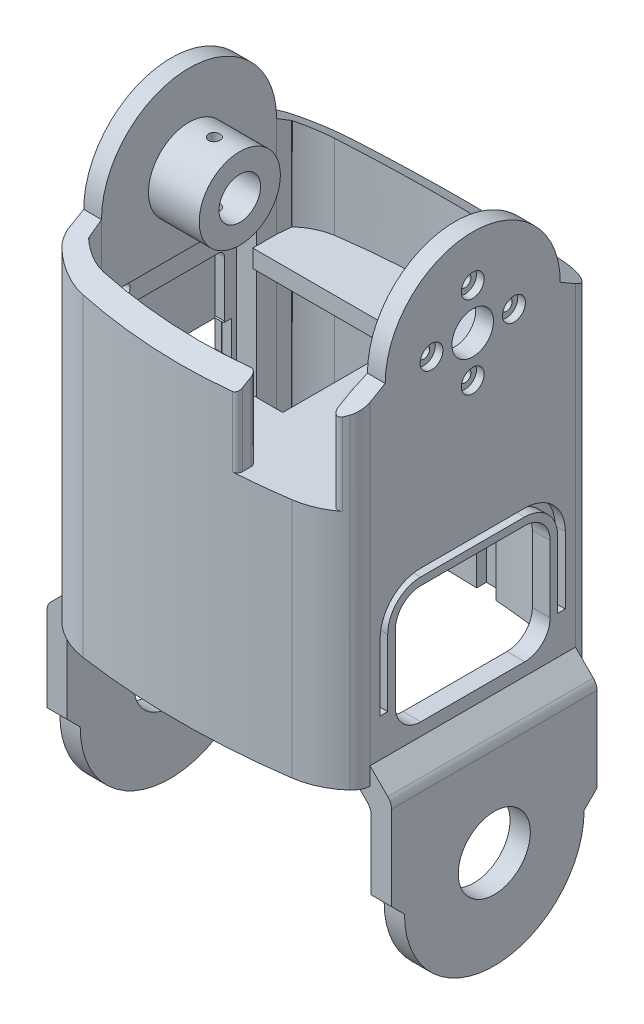
from build123d import *

# Parameters (mm, degrees)
SKETCH1_R                = 4.1
SKETCH1_R_2              = 1.15
BOSS_EXTRUDE1_DEPTH      = 3.5
BOSS_EXTRUDE2_DEPTH      = 67.25
CUT_EXTRUDE1_DEPTH       = 94.994268442
SKETCH4_W                = 26.5
SKETCH4_H                = 47.25
CUT_EXTRUDE2_DEPTH       = 3.5
SKETCH6_W                = 31.5
SKETCH6_H                = 52.25
BOSS_EXTRUDE3_DEPTH      = 2
CHAMFER2_SIZE            = 2
SKETCH7_W                = 26.5
SKETCH7_H                = 47.25
CUT_EXTRUDE3_DEPTH       = 0.8
CUT_EXTRUDE4_REACH       = 97.271
SKETCH8_W                = 21.401119101
SKETCH8_H                = 6.5
CUT_EXTRUDE5_REACH       = 97.271
SKETCH9_R                = 7.1
BOSS_EXTRUDE4_DEPTH      = 3.5
SKETCH11_W               = 4
SKETCH11_H               = 49.717369648
BOSS_EXTRUDE5_DEPTH      = 40
SKETCH12_R               = 7.1
CUT_EXTRUDE6_DEPTH       = 10
CHAMFER3_SIZE            = 1
CHAMFER4_SIZE            = 1
FILLET1_R                = 3
SKETCH13_R               = 9
SKETCH13_R_2             = 5.5
BOSS_EXTRUDE6_DEPTH      = 1.5
SKETCH16_R               = 9
BOSS_EXTRUDE7_DEPTH      = 1
FILLET2_R                = 1
SKETCH18_R               = 9
SKETCH18_R_2             = 7.1
BOSS_EXTRUDE8_DEPTH      = 0.5
CHAMFER5_SIZE            = 0.5
BOSS_EXTRUDE9_DEPTH      = 40.5
CUT_EXTRUDE8_REACH       = 129.458
CHAMFER6_SIZE            = 1.5
CUT_EXTRUDE9_REACH       = 129.458
SKETCH20_R               = 7.1
SKETCH21_R               = 1.5
BOSS_EXTRUDE10_DEPTH     = 3.5
CUT_EXTRUDE10_REACH      = 129.458
SKETCH22_R               = 3.75
SKETCH23_R               = 1.15
BOSS_EXTRUDE11_DEPTH     = 1.82
BOSS_EXTRUDE12_START     = 2.65
SKETCH24_W               = 5
SKETCH24_H               = 15.934069979
SKETCH24_R               = 1.15
BOSS_EXTRUDE12_DEPTH     = 2.65
CUT_EXTRUDE11_REACH      = 118.561
SKETCH25_R               = 1.15
SKETCH26_R               = 13.375
CUT_EXTRUDE12_DEPTH      = 3.3
SKETCH27_R               = 5
BOSS_EXTRUDE13_DEPTH     = 1
FILLET7_R                = 0.75
SKETCH28_R               = 8
SKETCH28_R_2             = 4.1
BOSS_EXTRUDE14_DEPTH     = 1.5
SKETCH29_R               = 8
SKETCH29_R_2             = 4.1
BOSS_EXTRUDE15_DEPTH     = 8.5
CUT_EXTRUDE13_DEPTH      = 15
CUT_EXTRUDE13_DEPTH_BACK = 127.447026853
SKETCH30_R               = 1.125
SKETCH31_R               = 7.1
BOSS_EXTRUDE16_DEPTH     = 0.5
CHAMFER7_SIZE            = 0.5
CHAMFER7_OF_MIRROR5_SIZE = 0.5
FILLET8_R                = 2.5
CUT_EXTRUDE14_DEPTH      = 10
CUT_EXTRUDE14_DEPTH_BACK = 10
SKETCH32_W               = 30.5
SKETCH32_H               = 23.22
FILLET9_R                = 5
CUT_EXTRUDE15_DEPTH      = 2
SKETCH34_R               = 2.25
CUT_EXTRUDE16_DEPTH      = 1.5
CUT_EXTRUDE17_DEPTH      = 133.651095359
CUT_EXTRUDE17_DEPTH_BACK = 2
SKETCH35_W               = 15
SKETCH35_H               = 21.75
FILLET10_R               = 1
FILLET11_R               = 1
SKETCH36_R               = 1.15
CUT_EXTRUDE18_DEPTH      = 127.188133356
CUT_EXTRUDE20_DEPTH      = 10
CUT_EXTRUDE20_DEPTH_BACK = 40


# Some blends are built 0.0001 mm under size
with BuildPart() as part:
    # Sketch1 → Boss-Extrude1 (new body)
    with BuildSketch(Plane(origin=(0, 0, 0), x_dir=(0, 0, -1), z_dir=(1, 0, 0))):
        with BuildLine():
            Line((-17.25, 0), (-17.25, -67.25))
            Line((-17.25, -67.25), (17.25, -67.25))
            Line((17.25, -67.25), (17.25, 0))
            ThreePointArc((17.25, 0), (0, 17.25), (-17.25, 0))
        make_face()
        Circle(SKETCH1_R, mode=Mode.SUBTRACT)
        with Locations((0, 8.125)):
            Circle(SKETCH1_R_2, mode=Mode.SUBTRACT)
        with Locations((8.125, 0)):
            Circle(SKETCH1_R_2, mode=Mode.SUBTRACT)
        with Locations((-8.125, 0)):
            Circle(SKETCH1_R_2, mode=Mode.SUBTRACT)
        with Locations((0, -8.125)):
            Circle(SKETCH1_R_2, mode=Mode.SUBTRACT)
    boss_extrude1 = extrude(amount=BOSS_EXTRUDE1_DEPTH)

    # Sketch2 → Boss-Extrude2 (add)
    with BuildSketch(Plane(origin=(0, 0, 0), x_dir=(-1, 0, 0), z_dir=(0, -1, 0))):
        with BuildLine():
            Line((-59.4, -17.25), (-59.4, -20.25))
            ThreePointArc((-59.4, -20.25), (-58.989582055, -21.693064324), (-58.079872716, -22.886088403))
            ThreePointArc((-58.079872716, -22.886088403), (-54.454905265, -25.285822393), (-50.289145158, -26.529025904))
            ThreePointArc((-50.289145158, -26.529025904), (-40.020812264, -27.631788405), (-29.7, -28))
            ThreePointArc((-29.7, -28), (-19.379187736, -27.631788405), (-9.110854842, -26.529025904))
            ThreePointArc((-9.110854842, -26.529025904), (-4.945094735, -25.285822393), (-1.320127284, -22.886088403))
            ThreePointArc((-1.320127284, -22.886088403), (-0.410417945, -21.693064324), (0, -20.25))
            Line((0, -20.25), (0, -17.25))
            Line((0, -17.25), (-3.5, -17.25))
            Line((-3.5, -17.25), (-3.735903774, -19.954735321))
            ThreePointArc((-3.735903774, -19.954735321), (-3.770225997, -20.037754997), (-3.828562802, -20.106071165))
            ThreePointArc((-3.828562802, -20.106071165), (-6.407189742, -21.835001354), (-9.364778442, -22.779027613))
            ThreePointArc((-9.364778442, -22.779027613), (-19.505740765, -23.883479028), (-29.7, -24.2522722))
            ThreePointArc((-29.7, -24.2522722), (-39.894259235, -23.883479028), (-50.035221558, -22.779027613))
            ThreePointArc((-50.035221558, -22.779027613), (-52.992810258, -21.835001354), (-55.571437198, -20.106071165))
            ThreePointArc((-55.571437198, -20.106071165), (-55.629774003, -20.037754997), (-55.664096226, -19.954735321))
            Line((-55.664096226, -19.954735321), (-55.9, -17.25))
            Line((-55.9, -17.25), (-59.4, -17.25))
        make_face()
    boss_extrude2 = extrude(amount=BOSS_EXTRUDE2_DEPTH)

    # Mirror2: Boss-Extrude1 across plane
    add(boss_extrude1.mirror(Plane.ZY.offset(-29.7)))

    # Sketch3 → Cut-Extrude1 (cut, through all)
    with BuildSketch(Plane.ZY):
        Polygon((17.25, 0), (32.748612496, -8.948128097), (32.748612496, 0), align=None)
    cut_extrude1 = extrude(amount=-CUT_EXTRUDE1_DEPTH, mode=Mode.SUBTRACT)

    # Mirror3: Boss-Extrude2, Cut-Extrude1 across plane
    add(boss_extrude2.mirror(Plane(origin=(0, 0, 0), x_dir=(1, 0, 0), z_dir=(0, 0, -1))))
    add(cut_extrude1.mirror(Plane(origin=(0, 0, 0), x_dir=(1, 0, 0), z_dir=(0, 0, -1))), mode=Mode.SUBTRACT)

    # Sketch4 → Cut-Extrude2 (cut)
    with BuildSketch(Plane.ZY):
        with Locations((0, -37.125)):
            Rectangle(SKETCH4_W, SKETCH4_H)
    extrude(amount=-CUT_EXTRUDE2_DEPTH, mode=Mode.SUBTRACT)

    # Sketch6 → Boss-Extrude3 (add)
    with BuildSketch(Plane.ZY):
        with Locations((0, -37.125)):
            Rectangle(SKETCH6_W, SKETCH6_H)
    extrude(amount=BOSS_EXTRUDE3_DEPTH)

    # Chamfer2
    chamfer2_edges = [part.edges().sort_by_distance(p)[0] for p in [
        (-2, -63.25, 0),
        (-2, -37.125, 15.75),
        (-2, -37.125, -15.75),
        (-2, -11, 0),
    ]]
    chamfer(chamfer2_edges, length=CHAMFER2_SIZE - 0.0001)  # a hair under: the kernel refuses the full size

    # Sketch7 → Cut-Extrude3 (cut)
    with BuildSketch(Plane(origin=(0, 0, 0), x_dir=(0, 0, -1), z_dir=(1, 0, 0))):
        with Locations((0, -37.125)):
            Rectangle(SKETCH7_W, SKETCH7_H)
    extrude(amount=-CUT_EXTRUDE3_DEPTH, mode=Mode.SUBTRACT)

    # Sketch8 → Cut-Extrude4 (cut, up to next)
    with BuildSketch(Plane.ZY.offset(2), mode=Mode.PRIVATE) as cut_extrude4_sk1:
        with Locations((0.049440449, -35.5)):
            Rectangle(SKETCH8_W, SKETCH8_H)
    cut_extrude4_tool1 = extrude(cut_extrude4_sk1.sketch, amount=-CUT_EXTRUDE4_REACH, mode=Mode.PRIVATE) & part.part
    add(cut_extrude4_tool1.solids().sort_by_distance((-2, -35.5, 0.04944))[0], mode=Mode.SUBTRACT)

    # Sketch9 → Cut-Extrude5 (cut, up to next)
    with BuildSketch(Plane(origin=(59.4, 0, 0), x_dir=(0, 0, -1), z_dir=(1, 0, 0)), mode=Mode.PRIVATE) as cut_extrude5_sk1:
        with Locations((0, -49.64)):
            Circle(SKETCH9_R)
    cut_extrude5_tool1 = extrude(cut_extrude5_sk1.sketch, amount=-CUT_EXTRUDE5_REACH, mode=Mode.PRIVATE) & part.part
    add(cut_extrude5_tool1.solids().sort_by_distance((59.4, -49.64, 0))[0], mode=Mode.SUBTRACT)

    # Sketch10 → Boss-Extrude4 (add)
    with BuildSketch(Plane(origin=(0, -19.75, 0), x_dir=(-1, 0, 0), z_dir=(0, -1, 0))):
        with BuildLine():
            Line((-55.664096226, -19.954735321), (-55.9, -17.25))
            Line((-55.9, -17.25), (-55.9, 17.25))
            Line((-55.9, 17.25), (-55.664096226, 19.954735321))
            ThreePointArc((-55.664096226, 19.954735321), (-55.629774003, 20.037754997), (-55.571437198, 20.106071165))
            ThreePointArc((-55.571437198, 20.106071165), (-52.992810258, 21.835001354), (-50.035221558, 22.779027613))
            ThreePointArc((-50.035221558, 22.779027613), (-29.7, 24.2522722), (-9.364778442, 22.779027613))
            ThreePointArc((-9.364778442, 22.779027613), (-6.407189742, 21.835001354), (-3.828562802, 20.106071165))
            ThreePointArc((-3.828562802, 20.106071165), (-3.770225997, 20.037754997), (-3.735903774, 19.954735321))
            Line((-3.735903774, 19.954735321), (-3.5, 17.25))
            Line((-3.5, 17.25), (-3.5, 12.559999042))
            Line((-3.5, 12.559999042), (-34.519998723, 12.559999042))
            Line((-34.519998723, 12.559999042), (-34.519998723, -12.559999407))
            Line((-34.519998723, -12.559999407), (-3.5, -12.559999407))
            Line((-3.5, -12.559999407), (-3.5, -17.25))
            Line((-3.5, -17.25), (-3.735903774, -19.954735321))
            ThreePointArc((-3.735903774, -19.954735321), (-3.770225997, -20.037754997), (-3.828562802, -20.106071165))
            ThreePointArc((-3.828562802, -20.106071165), (-6.407189742, -21.835001354), (-9.364778442, -22.779027613))
            ThreePointArc((-9.364778442, -22.779027613), (-29.7, -24.2522722), (-50.035221558, -22.779027613))
            ThreePointArc((-50.035221558, -22.779027613), (-52.992810258, -21.835001354), (-55.571437198, -20.106071165))
            ThreePointArc((-55.571437198, -20.106071165), (-55.629774003, -20.037754997), (-55.664096226, -19.954735321))
        make_face()
    extrude(amount=BOSS_EXTRUDE4_DEPTH)

    # Sketch11 → Boss-Extrude5 (add)
    with BuildSketch(Plane(origin=(0, -23.25, 0), x_dir=(-1, 0, 0), z_dir=(0, -1, 0))):
        with Locations((-38.07, 0.750293773)):
            Rectangle(SKETCH11_W, SKETCH11_H)
    extrude(amount=BOSS_EXTRUDE5_DEPTH)

    # Sketch12 → Cut-Extrude6 (cut)
    with BuildSketch(Plane(origin=(40.07, 0, 0), x_dir=(0, 0, -1), z_dir=(1, 0, 0))):
        with Locations((0, -49.64)):
            Circle(SKETCH12_R)
    extrude(amount=-CUT_EXTRUDE6_DEPTH, mode=Mode.SUBTRACT)

    # Chamfer3
    chamfer3_edges = [part.edges().sort_by_distance(p)[0] for p in [
        (36.07, -23.25, 0),
    ]]
    chamfer(chamfer3_edges, length=CHAMFER3_SIZE)

    # Chamfer4
    chamfer4_edges = [part.edges().sort_by_distance(p)[0] for p in [
        (40.07, -23.25, 0),
    ]]
    chamfer(chamfer4_edges, length=CHAMFER4_SIZE)

    # Fillet1
    fillet1_edges = [part.edges().sort_by_distance(p)[0] for p in [
        (38.07084415, -63.25, 24.003715904),
        (38.07084415, -63.25, -24.003715904),
    ]]
    fillet(fillet1_edges, radius=FILLET1_R)

    # Sketch13 → Boss-Extrude6 (add)
    with BuildSketch(Plane(origin=(59.4, 0, 0), x_dir=(0, 0, -1), z_dir=(1, 0, 0))):
        with Locations(Location((0, -49.64, 0), (0, 0, 180))):
            Circle(SKETCH13_R)
        with Locations((0, -49.64)):
            Circle(SKETCH13_R_2, mode=Mode.SUBTRACT)
    extrude(amount=BOSS_EXTRUDE6_DEPTH)

    # Sketch16 → Boss-Extrude7 (add)
    with BuildSketch(Plane(origin=(60.9, 0, 0), x_dir=(0, 0, -1), z_dir=(1, 0, 0))):
        with Locations(Location((0, -49.64, 0), (0, 0, 180))):
            Circle(SKETCH16_R)
    extrude(amount=BOSS_EXTRUDE7_DEPTH)

    # Fillet2
    fillet2_edges = [part.edges().sort_by_distance(p)[0] for p in [
        (61.9, -49.64, -9),
    ]]
    fillet(fillet2_edges, radius=FILLET2_R)

    # Sketch18 → Boss-Extrude8 (add)
    with BuildSketch(Plane.ZY.offset(-55.9)):
        with Locations((0, -49.64)):
            Circle(SKETCH18_R)
        with Locations(Location((0, -49.64, 0), (0, 0, 180))):
            Circle(SKETCH18_R_2, mode=Mode.SUBTRACT)
    extrude(amount=BOSS_EXTRUDE8_DEPTH)

    # Chamfer5
    chamfer5_edges = [part.edges().sort_by_distance(p)[0] for p in [
        (55.9, -49.64, -9),
    ]]
    chamfer(chamfer5_edges, length=CHAMFER5_SIZE - 0.0001)  # a hair under: the kernel refuses the full size

    # Sketch17 → Boss-Extrude9 (add)
    with BuildSketch(Plane(origin=(0, 0, 20.25), x_dir=(-1, 0, 0), z_dir=(0, 0, -1))):
        Polygon((-59.65, -105.91), (-63.15, -105.91), (-63.15, -67.5), (-59.4, -63.75), (-59.4, -67.25), (-55.9, -67.25), (-59.65, -71), align=None)
    boss_extrude9 = extrude(amount=BOSS_EXTRUDE9_DEPTH)

    # Sketch19 → Cut-Extrude8 (cut, up to next)
    with BuildSketch(Plane(origin=(63.15, 0, 0), x_dir=(0, 0, -1), z_dir=(1, 0, 0)), mode=Mode.PRIVATE) as cut_extrude8_sk1:
        with BuildLine():
            ThreePointArc((0, -105.91), (-12.515790027, -100.725790027), (-17.7, -88.21))
            Line((-17.7, -88.21), (-20.25, -85.66))
            Line((-20.25, -85.66), (-20.25, -105.91))
            Line((-20.25, -105.91), (0, -105.91))
        make_face()
    cut_extrude8_tool1 = extrude(cut_extrude8_sk1.sketch, amount=-CUT_EXTRUDE8_REACH, mode=Mode.PRIVATE) & part.part
    # Sketch19 → Cut-Extrude8 (cut, up to next)
    with BuildSketch(Plane(origin=(63.15, 0, 0), x_dir=(0, 0, -1), z_dir=(1, 0, 0)), mode=Mode.PRIVATE) as cut_extrude8_sk2:
        with BuildLine():
            ThreePointArc((17.7, -88.21), (12.515790027, -100.725790027), (0, -105.91))
            Line((0, -105.91), (20.25, -105.91))
            Line((20.25, -105.91), (20.25, -85.66))
            Line((20.25, -85.66), (17.7, -88.21))
        make_face()
    cut_extrude8_tool2 = extrude(cut_extrude8_sk2.sketch, amount=-CUT_EXTRUDE8_REACH, mode=Mode.PRIVATE) & part.part
    cut_extrude8_1 = cut_extrude8_tool1.solids().sort_by_distance((63.15, -99.634492, 15.946502))[0]
    add(cut_extrude8_1, mode=Mode.SUBTRACT)
    cut_extrude8_2 = cut_extrude8_tool2.solids().sort_by_distance((63.15, -99.634492, -15.946502))[0]
    add(cut_extrude8_2, mode=Mode.SUBTRACT)
    cut_extrude8 = cut_extrude8_1 + cut_extrude8_2  # Cut-Extrude8 as one shape, for the pattern or mirror that repeats it

    # Chamfer6
    chamfer6_edges = [part.edges().sort_by_distance(p)[0] for p in [
        (59.4, -49.64, -9),
    ]]
    chamfer(chamfer6_edges, length=CHAMFER6_SIZE - 0.0001)  # a hair under: the kernel refuses the full size

    # Sketch20 → Cut-Extrude9 (cut, up to next)
    with BuildSketch(Plane(origin=(63.15, 0, 0), x_dir=(0, 0, -1), z_dir=(1, 0, 0)), mode=Mode.PRIVATE) as cut_extrude9_sk1:
        with Locations(Location((0, -86.64, 0), (0, 0, 90))):
            Circle(SKETCH20_R)
    cut_extrude9_tool1 = extrude(cut_extrude9_sk1.sketch, amount=-CUT_EXTRUDE9_REACH, mode=Mode.PRIVATE) & part.part
    cut_extrude9 = cut_extrude9_tool1.solids().sort_by_distance((63.15, -86.64, 0))[0]
    add(cut_extrude9, mode=Mode.SUBTRACT)

    # Sketch21 → Boss-Extrude10 (add)
    with BuildSketch(Plane.ZY):
        with Locations((0, 8.125)):
            Circle(SKETCH21_R)
        with Locations((8.125, 0)):
            Circle(SKETCH21_R)
        with Locations((0, -8.125)):
            Circle(SKETCH21_R)
        with Locations((-8.125, 0)):
            Circle(SKETCH21_R)
    extrude(amount=-BOSS_EXTRUDE10_DEPTH)

    # Mirror4: Boss-Extrude9, Cut-Extrude8, Cut-Extrude9 across plane
    add(boss_extrude9.mirror(Plane.ZY.offset(-29.7)))
    add(cut_extrude8.mirror(Plane.ZY.offset(-29.7)), mode=Mode.SUBTRACT)
    add(cut_extrude9.mirror(Plane.ZY.offset(-29.7)), mode=Mode.SUBTRACT)

    # Sketch22 → Cut-Extrude10 (cut, up to next)
    with BuildSketch(Plane.ZY.offset(2), mode=Mode.PRIVATE) as cut_extrude10_sk1:
        with Locations((0, -49.64)):
            Circle(SKETCH22_R)
    cut_extrude10_tool1 = extrude(cut_extrude10_sk1.sketch, amount=-CUT_EXTRUDE10_REACH, mode=Mode.PRIVATE) & part.part
    add(cut_extrude10_tool1.solids().sort_by_distance((-2, -49.64, 0))[0], mode=Mode.SUBTRACT)

    # Sketch23 → Boss-Extrude11 (add)
    with BuildSketch(Plane(origin=(-0.8, 0, 0), x_dir=(0, 0, -1), z_dir=(1, 0, 0))):
        with BuildLine():
            Line((10.8, -38.889999996), (6.999999457, -38.890000068))
            Line((6.999999457, -38.890000068), (6.999996312, -40.653616778))
            ThreePointArc((6.999996312, -40.653616778), (8.489057136, -42.044544733), (9.706479797, -43.678516819))
            Line((9.706479797, -43.678516819), (11.359988862, -43.678515032))
            ThreePointArc((11.359988862, -43.678515032), (11.713588357, -43.532032852), (11.859995379, -43.178403539))
            Line((11.859995379, -43.178403539), (11.86002914, -16.529542904))
            add(Edge.make_bspline(
                [(11.86002914, -16.529542904), (11.860165313, -16.430469267), (11.850209846, -16.333113479), (11.811929636, -16.141528813), (11.783134355, -16.046307589), (11.707972993, -15.864777212), (11.661801756, -15.778752889), (11.553004371, -15.615785201), (11.48982416, -15.538574617), (11.282494862, -15.331229176), (11.115347595, -15.219447642), (10.754781823, -15.069949312), (10.558116563, -15.029804422), (10.360121847, -15.029962825)],
                knots=[0, 0, 0, 0, 0.125, 0.125, 0.25, 0.25, 0.375, 0.375, 0.5, 0.5, 0.75, 0.75, 1, 1, 1, 1], degree=3))
            Line((10.360121847, -15.029962825), (-10.360414785, -15.029965499))
            add(Edge.make_bspline(
                [(-10.360414785, -15.029965499), (-10.459488561, -15.029826786), (-10.556844718, -15.039779883), (-10.748430568, -15.078055492), (-10.843652616, -15.10684852), (-11.025185073, -15.18200551), (-11.111210651, -15.228174695), (-11.274181245, -15.336968247), (-11.351393467, -15.400146655), (-11.558744183, -15.60747118), (-11.670529896, -15.774615995), (-11.820037045, -16.135178663), (-11.86018697, -16.331843248), (-11.860032668, -16.529838302)],
                knots=[0, 0, 0, 0, 0.125, 0.125, 0.25, 0.25, 0.375, 0.375, 0.5, 0.5, 0.75, 0.75, 1, 1, 1, 1], degree=3))
            Line((-11.860032668, -16.529838302), (-11.860001151, -43.178485794))
            ThreePointArc((-11.860001151, -43.178485794), (-11.713562299, -43.532062592), (-11.359992206, -43.678517633))
            Line((-11.359992206, -43.678517633), (-9.706483935, -43.678519702))
            ThreePointArc((-9.706483935, -43.678519702), (-8.489059663, -42.044544533), (-6.999996328, -40.653614235))
            Line((-6.999996328, -40.653614235), (-6.99999946, -38.890000068))
            Line((-6.99999946, -38.890000068), (-10.8, -38.889999996))
            Line((-10.8, -38.889999996), (-10.8, -32.115))
            Line((-10.8, -32.115), (-9.303042913, -32.115))
            Line((-9.303042913, -32.115), (-9.442286694, -31.892101192))
            Line((-9.442286694, -31.892101192), (-9.442286694, -20.936914675))
            ThreePointArc((-9.442286694, -20.936914675), (-9.09081483, -20.088386539), (-8.242286694, -19.736914678))
            Line((-8.242286694, -19.736914678), (8.242286696, -19.736914678))
            ThreePointArc((8.242286696, -19.736914678), (9.090814832, -20.088386541), (9.442286694, -20.936914678))
            Line((9.442286694, -20.936914678), (9.442286694, -31.892101192))
            Line((9.442286694, -31.892101192), (9.303042913, -32.115))
            Line((9.303042913, -32.115), (10.8, -32.115))
            Line((10.8, -32.115), (10.8, -38.889999996))
        make_face()
        with Locations(Location((-10.25, -16.89, 0), (0, 0, 180))):
            Circle(SKETCH23_R, mode=Mode.SUBTRACT)
        with Locations(Location((10.25, -16.89, 0), (0, 0, 180))):
            Circle(SKETCH23_R, mode=Mode.SUBTRACT)
        with Locations(Location((10.25, -41.34, 0), (0, 0, 180))):
            Circle(SKETCH23_R, mode=Mode.SUBTRACT)
        with Locations(Location((-10.25, -41.34, 0), (0, 0, 180))):
            Circle(SKETCH23_R, mode=Mode.SUBTRACT)
    extrude(amount=BOSS_EXTRUDE11_DEPTH)

    # Sketch24 → Boss-Extrude12 (add)
    # profile 1 of 2: a face of its own
    with BuildSketch(Plane.ZY.offset(-36.07).offset(BOSS_EXTRUDE12_START)):
        with Locations((-10.5, -37.242079847)):
            Rectangle(SKETCH24_W, SKETCH24_H)
        with Locations((-10.25, -41.34)):
            Circle(SKETCH24_R, mode=Mode.SUBTRACT)
    # profile 2 of 2: a face of its own
    with BuildSketch(Plane.ZY.offset(-36.07).offset(BOSS_EXTRUDE12_START)):
        with Locations((10.5, -37.242079847)):
            Rectangle(SKETCH24_W, SKETCH24_H)
        with Locations((10.25, -41.34)):
            Circle(SKETCH24_R, mode=Mode.SUBTRACT)
    extrude(amount=-BOSS_EXTRUDE12_DEPTH)

    # Sketch25 → Cut-Extrude11 (cut, up to next)
    with BuildSketch(Plane.ZY.offset(-36.07), mode=Mode.PRIVATE) as cut_extrude11_sk1:
        with Locations((10.25, -41.34)):
            Circle(SKETCH25_R)
    cut_extrude11_tool1 = extrude(cut_extrude11_sk1.sketch, amount=-CUT_EXTRUDE11_REACH, mode=Mode.PRIVATE) & part.part
    # Sketch25 → Cut-Extrude11 (cut, up to next)
    with BuildSketch(Plane.ZY.offset(-36.07), mode=Mode.PRIVATE) as cut_extrude11_sk2:
        with Locations((-10.25, -41.34)):
            Circle(SKETCH25_R)
    cut_extrude11_tool2 = extrude(cut_extrude11_sk2.sketch, amount=-CUT_EXTRUDE11_REACH, mode=Mode.PRIVATE) & part.part
    add(cut_extrude11_tool1.solids().sort_by_distance((36.07, -41.34, 10.25))[0], mode=Mode.SUBTRACT)
    add(cut_extrude11_tool2.solids().sort_by_distance((36.07, -41.34, -10.25))[0], mode=Mode.SUBTRACT)

    # Sketch26 → Cut-Extrude12 (cut)
    with BuildSketch(Plane.ZY):
        Circle(SKETCH26_R)
    extrude(amount=CUT_EXTRUDE12_DEPTH, mode=Mode.SUBTRACT)

    # Sketch27 → Boss-Extrude13 (add)
    with BuildSketch(Plane.ZY.offset(2)):
        with Locations((0, -49.64)):
            Circle(SKETCH27_R)
    extrude(amount=BOSS_EXTRUDE13_DEPTH)

    # Fillet7
    fillet7_edges = [part.edges().sort_by_distance(p)[0] for p in [
        (-3, -49.64, -5),
    ]]
    fillet(fillet7_edges, radius=FILLET7_R)

    # Sketch28 → Boss-Extrude14 (add)
    with BuildSketch(Plane(origin=(3.5, 0, 0), x_dir=(0, 0, -1), z_dir=(1, 0, 0))):
        Circle(SKETCH28_R)
        Circle(SKETCH28_R_2, mode=Mode.SUBTRACT)
    extrude(amount=BOSS_EXTRUDE14_DEPTH)

    # Sketch29 → Boss-Extrude15 (add)
    with BuildSketch(Plane(origin=(5, 0, 0), x_dir=(0, 0, -1), z_dir=(1, 0, 0))):
        Circle(SKETCH29_R)
        Circle(SKETCH29_R_2, mode=Mode.SUBTRACT)
    extrude(amount=BOSS_EXTRUDE15_DEPTH)

    # Sketch30 → Cut-Extrude13 (cut, two sides: drawn at the far end of the back side and taken through both)
    with BuildSketch(Plane(origin=(0, 0, 0), x_dir=(-1, 0, 0), z_dir=(0, -1, 0)).offset(-CUT_EXTRUDE13_DEPTH_BACK)):
        with Locations(Location((-8.5, 0, 0), (0, 0, 270))):
            Circle(SKETCH30_R)
    extrude(amount=CUT_EXTRUDE13_DEPTH + CUT_EXTRUDE13_DEPTH_BACK, mode=Mode.SUBTRACT)

    # Sketch31 → Boss-Extrude16 (add)
    with BuildSketch(Plane.ZY.offset(3.75)):
        with BuildLine():
            Line((-20.25, -67.5), (-20.25, -85.66))
            Line((-20.25, -85.66), (-17.7, -88.21))
            ThreePointArc((-17.7, -88.21), (0, -105.91), (17.7, -88.21))
            Line((17.7, -88.21), (20.25, -85.66))
            Line((20.25, -85.66), (20.25, -67.5))
            Line((20.25, -67.5), (-20.25, -67.5))
        make_face()
        with Locations(Location((0, -86.64, 0), (0, 0, 90))):
            Circle(SKETCH31_R, mode=Mode.SUBTRACT)
    boss_extrude16 = extrude(amount=BOSS_EXTRUDE16_DEPTH)

    # Chamfer7
    chamfer7_edges = [part.edges().sort_by_distance(p)[0] for p in [
        (-4.25, -67.5, 0),
    ]]
    chamfer(chamfer7_edges, length=CHAMFER7_SIZE - 0.0001)  # a hair under: the kernel refuses the full size

    # Mirror5: Boss-Extrude16 across plane
    add(boss_extrude16.mirror(Plane(origin=(29.7, 0, 0), x_dir=(0, 0, 1), z_dir=(1, 0, 0))))

    # Chamfer7 of Mirror5
    chamfer7_of_mirror5_edges = [part.edges().sort_by_distance(p)[0] for p in [
        (63.65, -67.5, 0),
    ]]
    chamfer(chamfer7_of_mirror5_edges, length=CHAMFER7_OF_MIRROR5_SIZE - 0.0001)  # a hair under: the kernel refuses the full size

    # Fillet8
    # the kernel refuses this fillet: 2.5 mm, written as the material it adds along each edge
    with BuildSketch(Plane(origin=(59.65, -71, 20.25), x_dir=(0, -1, 0), z_dir=(0, 0, -1)), Plane(origin=(-0.25, -71, 20.25), x_dir=(0.7071067811865557, 0.7071067811865394, 0), z_dir=(0, 0, -1))) as fillet8_piece_1:
        with BuildLine():
            CenterArc((FILLET8_R * 0.414213562373, FILLET8_R), FILLET8_R, 225, 45)
            Line((-FILLET8_R * 0.292893218813, FILLET8_R * 0.292893218813), (0, 0))
            Line((0, 0), (FILLET8_R * 0.414213562373, 0))
        make_face()
    extrude(amount=40.5)
    # the kernel refuses this fillet: 2.5 mm, written as the material it takes off along each edge
    with BuildSketch(Plane(origin=(-4.25, -67.9999, 22.838834765), x_dir=(0, -1, 0), z_dir=(0, 0, -1))) as fillet8_2_piece_1:
        with BuildLine():
            CenterArc((FILLET8_R * 0.414213562373, -FILLET8_R), FILLET8_R, 90, 45)
            Line((-FILLET8_R * 0.292893218813, -FILLET8_R * 0.292893218813), (0, 0))
            Line((0, 0), (FILLET8_R * 0.414213562373, 0))
        make_face()
    extrude(amount=45.67766953, mode=Mode.SUBTRACT)
    with BuildSketch(Plane(origin=(63.65, -67.9999, 22.838834765), x_dir=(0, -1, 0), z_dir=(0, 0, -1))) as fillet8_2_piece_2:
        with BuildLine():
            CenterArc((FILLET8_R * 0.414213562373, FILLET8_R), FILLET8_R, 225, 45)
            Line((-FILLET8_R * 0.292893218813, FILLET8_R * 0.292893218813), (0, 0))
            Line((0, 0), (FILLET8_R * 0.414213562373, 0))
        make_face()
    extrude(amount=45.67766953, mode=Mode.SUBTRACT)

    # Sketch32 → Cut-Extrude14 (cut, two sides: drawn at the far end of the back side and taken through both)
    with BuildSketch(Plane(origin=(59.4, 0, 0), x_dir=(0, 0, -1), z_dir=(1, 0, 0)).offset(-CUT_EXTRUDE14_DEPTH_BACK)):
        with Locations((0, -49.64)):
            Rectangle(SKETCH32_W, SKETCH32_H)
    extrude(amount=CUT_EXTRUDE14_DEPTH + CUT_EXTRUDE14_DEPTH_BACK, mode=Mode.SUBTRACT)

    # Fillet9
    fillet9_edges = [part.edges().sort_by_distance(p)[0] for p in [
        (57.65, -38.03, 15.25),
        (57.65, -61.25, 15.25),
        (57.65, -61.25, -15.25),
        (57.65, -38.03, -15.25),
    ]]
    fillet(fillet9_edges, radius=FILLET9_R)

    # Sketch33 → Cut-Extrude15 (cut)
    with BuildSketch(Plane(origin=(59.4, 0, 0), x_dir=(0, 0, -1), z_dir=(1, 0, 0))):
        with BuildLine():
            Line((-18.25, -56.25), (-16.75, -56.25))
            Line((-16.75, -56.25), (-16.75, -43.03))
            ThreePointArc((-16.75, -43.03), (-14.846194078, -38.433805922), (-10.25, -36.53))
            Line((-10.25, -36.53), (10.25, -36.53))
            ThreePointArc((10.25, -36.53), (14.846194078, -38.433805922), (16.75, -43.03))
            Line((16.75, -43.03), (16.75, -56.25))
            Line((16.75, -56.25), (18.25, -56.25))
            Line((18.25, -56.25), (18.25, -43.03))
            ThreePointArc((18.25, -43.03), (15.906854249, -37.373145751), (10.25, -35.03))
            Line((10.25, -35.03), (-10.25, -35.03))
            ThreePointArc((-10.25, -35.03), (-15.906854249, -37.373145751), (-18.25, -43.03))
            Line((-18.25, -43.03), (-18.25, -56.25))
        make_face()
    extrude(amount=-CUT_EXTRUDE15_DEPTH, mode=Mode.SUBTRACT)

    # Sketch34 → Cut-Extrude16 (cut)
    with BuildSketch(Plane(origin=(59.4, 0, 0), x_dir=(0, 0, -1), z_dir=(1, 0, 0))):
        with Locations((0, 8.125)):
            Circle(SKETCH34_R)
        with Locations((8.125, 0)):
            Circle(SKETCH34_R)
        with Locations((0, -8.125)):
            Circle(SKETCH34_R)
        with Locations((-8.125, 0)):
            Circle(SKETCH34_R)
    extrude(amount=-CUT_EXTRUDE16_DEPTH, mode=Mode.SUBTRACT)

    # Sketch35 → Cut-Extrude17 (cut, two sides: drawn at the far end of the back side and taken through both)
    with BuildSketch(Plane.XY.offset(20.25).offset(-CUT_EXTRUDE17_DEPTH_BACK)):
        with Locations((48.15, -8.875)):
            Rectangle(SKETCH35_W, SKETCH35_H)
    extrude(amount=CUT_EXTRUDE17_DEPTH + CUT_EXTRUDE17_DEPTH_BACK, mode=Mode.SUBTRACT)

    # Fillet10
    fillet10_edges = [part.edges().sort_by_distance(p)[0] for p in [
        (40.65, -12.858590015, 27.585458991),
        (55.65, -12.013821491, 24.659094982),
    ]]
    fillet(fillet10_edges, radius=FILLET10_R)

    # Fillet11
    fillet11_edges = [part.edges().sort_by_distance(p)[0] for p in [
        (40.65, -11.773525783, 23.826686232),
    ]]
    fillet(fillet11_edges, radius=FILLET11_R)

    # Sketch36 → Cut-Extrude18 (cut, through all)
    with BuildSketch(Plane(origin=(1.02, 0, 0), x_dir=(0, 0, -1), z_dir=(1, 0, 0))):
        with Locations(Location((10.25, -41.34, 0), (0, 0, 180))):
            Circle(SKETCH36_R)
        with Locations(Location((10.25, -16.89, 0), (0, 0, 180))):
            Circle(SKETCH36_R)
        with Locations(Location((-10.25, -16.89, 0), (0, 0, 180))):
            Circle(SKETCH36_R)
        with Locations(Location((-10.25, -41.34, 0), (0, 0, 180))):
            Circle(SKETCH36_R)
    extrude(amount=-CUT_EXTRUDE18_DEPTH, mode=Mode.SUBTRACT)

    # Sketch37 → Cut-Extrude20 (cut, two sides: drawn at the far end of the back side and taken through both)
    # profile 1 of 2: a face of its own
    with BuildSketch(Plane.XZ.offset(63.25).offset(-CUT_EXTRUDE20_DEPTH_BACK)):
        with BuildLine():
            Line((40.07, -23.870636644), (40.07, -26.0079354))
            Line((40.07, -26.0079354), (36.07, -26.0079354))
            Line((36.07, -26.0079354), (36.07, -24.108391051))
            ThreePointArc((36.07, -24.108391051), (34.003152314, -24.186630775), (31.935379733, -24.234561595))
            Line((31.935379733, -24.234561595), (31.935379733, 24.234561595))
            ThreePointArc((31.935379733, 24.234561595), (34.003152314, 24.186630775), (36.07, 24.108391051))
            Line((36.07, 24.108391051), (36.07, 26.0079354))
            Line((36.07, 26.0079354), (40.07, 26.0079354))
            Line((40.07, 26.0079354), (40.07, 23.870636644))
            ThreePointArc((40.07, 23.870636644), (40.607246532, 23.830008061), (41.144333988, 23.787328054))
            Line((41.144333988, 23.787328054), (41.144333988, -23.787328054))
            ThreePointArc((41.144333988, -23.787328054), (40.607246532, -23.830008061), (40.07, -23.870636644))
        make_face()
        with BuildLine():
            Line((36.07, 21.105261724), (36.07, -21.105261724))
            ThreePointArc((36.07, -21.105261724), (38.070881372, -20.998303544), (40.07, -20.862321814))
            Line((40.07, -20.862321814), (40.07, 20.862321814))
            ThreePointArc((40.07, 20.862321814), (38.070881372, 20.998303544), (36.07, 21.105261724))
        make_face(mode=Mode.SUBTRACT)
    # profile 2 of 2: a face of its own
    with BuildSketch(Plane.XZ.offset(63.25).offset(-CUT_EXTRUDE20_DEPTH_BACK)):
        with BuildLine():
            ThreePointArc((40.07, 20.862321814), (38.070881372, 20.998303544), (36.07, 21.105261724))
            Line((36.07, 21.105261724), (36.07, -21.105261724))
            ThreePointArc((36.07, -21.105261724), (38.070881372, -20.998303544), (40.07, -20.862321814))
            Line((40.07, -20.862321814), (40.07, 20.862321814))
        make_face()
    extrude(amount=CUT_EXTRUDE20_DEPTH + CUT_EXTRUDE20_DEPTH_BACK, mode=Mode.SUBTRACT)


solid = part.part
